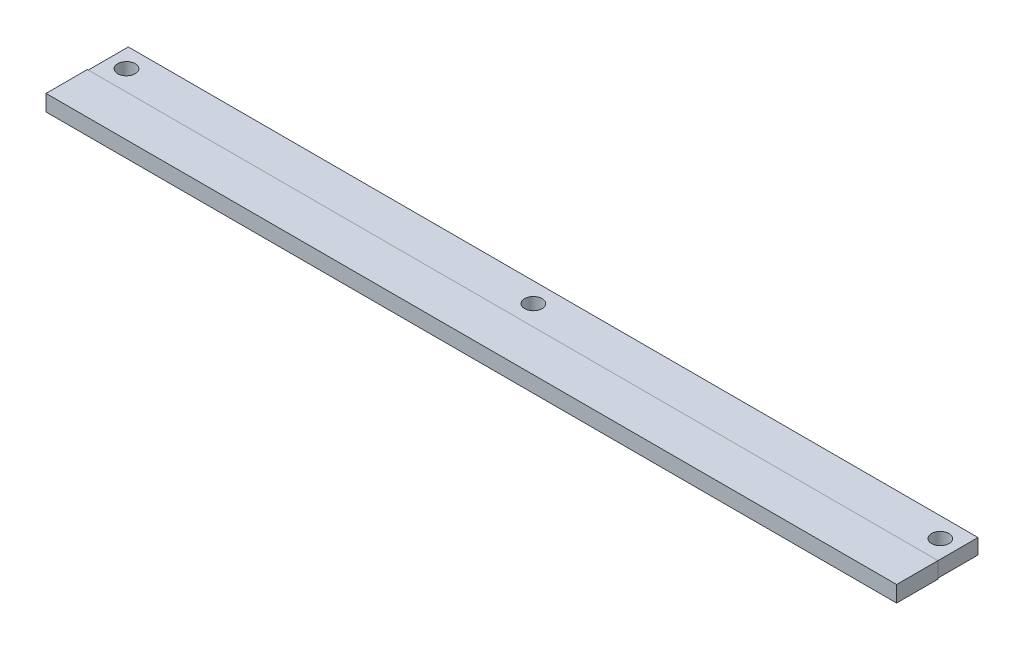
from build123d import *

# Parameters (mm, degrees)
SKETCH1_W           = 3.5
SKETCH1_H           = 185
BOSS_EXTRUDE1_DEPTH = 18
CUT_EXTRUDE1_REACH  = 187.907
SKETCH2_R           = 1.9
LPATTERN1_COUNT     = 3
LPATTERN1_PITCH     = 88.5
SKETCH3_W           = 185
SKETCH3_H           = 3.5
SKETCH3_W_2         = 184.8
SKETCH3_H_2         = 3.3
CUT_EXTRUDE2_DEPTH  = 9
CUT_EXTRUDE3_REACH  = 187.905
SKETCH5_W           = 184.8
SKETCH5_H           = 0.2


with BuildPart() as part:
    # Sketch1 → Boss-Extrude1 (new body)
    with BuildSketch(Plane(origin=(0, 0, 0), x_dir=(0, 1, 0), z_dir=(0, 0, 1))):
        with Locations((1.75, 92.5)):
            Rectangle(SKETCH1_W, SKETCH1_H)
    extrude(amount=BOSS_EXTRUDE1_DEPTH)

    # Sketch2 → Cut-Extrude1 (cut, up to next)
    with BuildSketch(Plane(origin=(0, 3.5, 0), x_dir=(-1, 0, 0), z_dir=(0, 1, 0)), mode=Mode.PRIVATE) as cut_extrude1_sk1:
        with Locations((181, 4.5)):
            Circle(SKETCH2_R)
    cut_extrude1_tool1 = extrude(cut_extrude1_sk1.sketch, amount=-CUT_EXTRUDE1_REACH, mode=Mode.PRIVATE) & part.part
    cut_extrude1 = cut_extrude1_tool1.solids().sort_by_distance((-181, 3.5, 4.5))[0]
    add(cut_extrude1, mode=Mode.SUBTRACT)

    # LPattern1: Cut-Extrude1 ×3
    with Locations(*[(i * LPATTERN1_PITCH, 0, 0) for i in range(1, LPATTERN1_COUNT)]):
        add(cut_extrude1, mode=Mode.SUBTRACT)

    # Sketch3 → Cut-Extrude2 (cut)
    with BuildSketch(Plane(origin=(0, 0, 0), x_dir=(1, 0, 0), z_dir=(0, 0, -1))):
        with Locations((-92.5, -1.75)):
            Rectangle(SKETCH3_W, SKETCH3_H)
        with Locations((-92.5, -1.75)):
            Rectangle(SKETCH3_W_2, SKETCH3_H_2, mode=Mode.SUBTRACT)
    extrude(amount=-CUT_EXTRUDE2_DEPTH, mode=Mode.SUBTRACT)

    # Sketch5 → Cut-Extrude3 (cut, up to next)
    with BuildSketch(Plane(origin=(0, 3.4, 0), x_dir=(-1, 0, 0), z_dir=(0, 1, 0)), mode=Mode.PRIVATE) as cut_extrude3_sk1:
        with Locations((92.5, 0.1)):
            Rectangle(SKETCH5_W, SKETCH5_H)
    cut_extrude3_tool1 = extrude(cut_extrude3_sk1.sketch, amount=-CUT_EXTRUDE3_REACH, mode=Mode.PRIVATE) & part.part
    add(cut_extrude3_tool1.solids().sort_by_distance((-92.5, 3.4, 0.1))[0], mode=Mode.SUBTRACT)


solid = part.part
